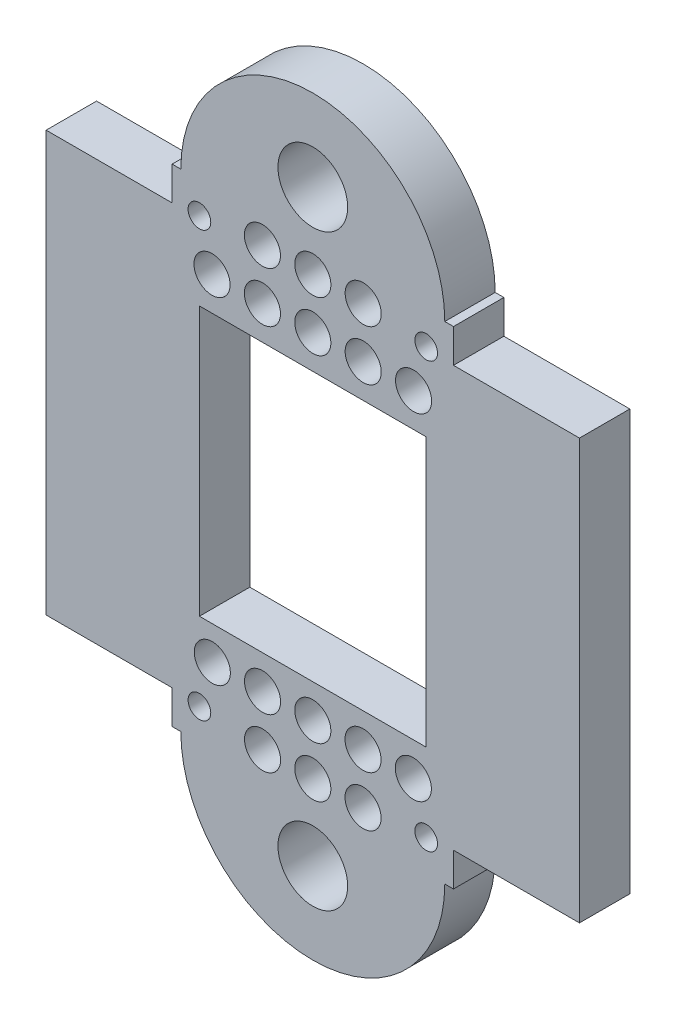
from build123d import *

# Parameters (mm, degrees)
SKETCH1_R           = 1.35
SKETCH1_R_2         = 4.15
SKETCH1_W           = 27
SKETCH1_H           = 32
BOSS_EXTRUDE1_DEPTH = 6
SKETCH2_R           = 2.15
CUT_EXTRUDE1_DEPTH  = 4.2


with BuildPart() as part:
    # Sketch1 → Boss-Extrude1 (new body)
    with BuildSketch(Plane.XY):
        with BuildLine():
            Line((-16.75, 29), (-15.715411776, 29))
            ThreePointArc((-15.715411776, 29), (0, 44.715411776), (15.715411776, 29))
            Line((15.715411776, 29), (16.75, 29))
            Line((16.75, 29), (16.75, 25))
            Line((16.75, 25), (31.75, 25))
            Line((31.75, 25), (31.75, -25))
            Line((31.75, -25), (16.75, -25))
            Line((16.75, -25), (16.75, -29))
            Line((16.75, -29), (15.715411776, -29))
            ThreePointArc((15.715411776, -29), (0, -44.715411776), (-15.715411776, -29))
            Line((-15.715411776, -29), (-16.75, -29))
            Line((-16.75, -29), (-16.75, -25))
            Line((-16.75, -25), (-31.75, -25))
            Line((-31.75, -25), (-31.75, 25))
            Line((-31.75, 25), (-16.75, 25))
            Line((-16.75, 25), (-16.75, 29))
        make_face()
        with Locations((-13.5, 25.3)):
            Circle(SKETCH1_R, mode=Mode.SUBTRACT)
        with Locations((13.5, -25.3)):
            Circle(SKETCH1_R, mode=Mode.SUBTRACT)
        with Locations((-13.5, -25.3)):
            Circle(SKETCH1_R, mode=Mode.SUBTRACT)
        with Locations((13.5, 25.3)):
            Circle(SKETCH1_R, mode=Mode.SUBTRACT)
        with Locations((0, 35)):
            Circle(SKETCH1_R_2, mode=Mode.SUBTRACT)
        with Locations((0, -35)):
            Circle(SKETCH1_R_2, mode=Mode.SUBTRACT)
        Rectangle(SKETCH1_W, SKETCH1_H, mode=Mode.SUBTRACT)
    extrude(amount=BOSS_EXTRUDE1_DEPTH)

    # Sketch2 → Cut-Extrude1 (cut)
    with BuildSketch(Plane.XY.offset(6)):
        with Locations((-12, 20)):
            Circle(SKETCH2_R)
        with Locations((-6, 20)):
            Circle(SKETCH2_R)
        with Locations((0, 20)):
            Circle(SKETCH2_R)
        with Locations((6, 20)):
            Circle(SKETCH2_R)
        with Locations((12, 20)):
            Circle(SKETCH2_R)
        with Locations((-6, 26)):
            Circle(SKETCH2_R)
        with Locations((0, 26)):
            Circle(SKETCH2_R)
        with Locations((6, 26)):
            Circle(SKETCH2_R)
        with Locations((-11.967349369, -20)):
            Circle(SKETCH2_R)
        with Locations((-5.983674685, -20)):
            Circle(SKETCH2_R)
        with Locations((0, -20)):
            Circle(SKETCH2_R)
        with Locations((5.983674685, -20)):
            Circle(SKETCH2_R)
        with Locations((11.967349369, -20)):
            Circle(SKETCH2_R)
        with Locations((-5.983674685, -26)):
            Circle(SKETCH2_R)
        with Locations((0, -26)):
            Circle(SKETCH2_R)
        with Locations((5.983674685, -26)):
            Circle(SKETCH2_R)
    extrude(amount=-CUT_EXTRUDE1_DEPTH, mode=Mode.SUBTRACT)


solid = part.part
